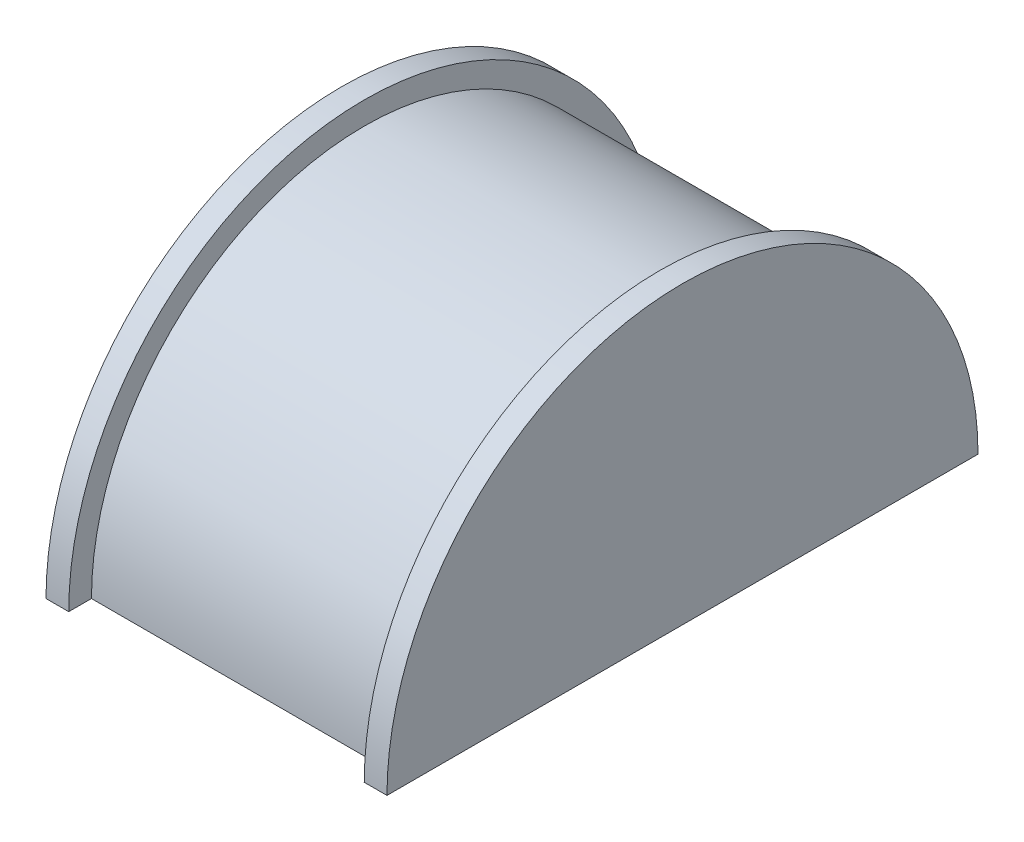
from build123d import *

# Parameters (mm, degrees)
BOSS_EXTRUDE1_DEPTH = 6.5
BOSS_EXTRUDE2_DEPTH = 0.5
SKETCH4_R           = 1.75
CUT_EXTRUDE1_DEPTH  = 5


with BuildPart() as part:
    # Sketch2 → Boss-Extrude1 (new body)
    with BuildSketch(Plane(origin=(0, 0, 0), x_dir=(0, 0, -1), z_dir=(1, 0, 0))):
        with BuildLine():
            Line((-6, 0), (6, 0))
            ThreePointArc((6, 0), (0, 6), (-6, 0))
        make_face()
    extrude(amount=BOSS_EXTRUDE1_DEPTH)

    # Sketch3 → Boss-Extrude2 (add)
    with BuildSketch(Plane(origin=(6.5, 0, 0), x_dir=(0, 0, -1), z_dir=(1, 0, 0))):
        with BuildLine():
            Line((-6.5, 0), (6.5, 0))
            ThreePointArc((6.5, 0), (0, 6.5), (-6.5, 0))
        make_face()
    boss_extrude2 = extrude(amount=BOSS_EXTRUDE2_DEPTH)

    # Mirror1: Boss-Extrude2 across plane
    add(boss_extrude2.mirror(Plane(origin=(3.25, 0, 0), x_dir=(0, 0, 1), z_dir=(1, 0, 0))))

    # Sketch4 → Cut-Extrude1 (cut)
    with BuildSketch(Plane.XZ):
        with Locations((3.25, 0)):
            Circle(SKETCH4_R)
    extrude(amount=-CUT_EXTRUDE1_DEPTH, mode=Mode.SUBTRACT)


solid = part.part
